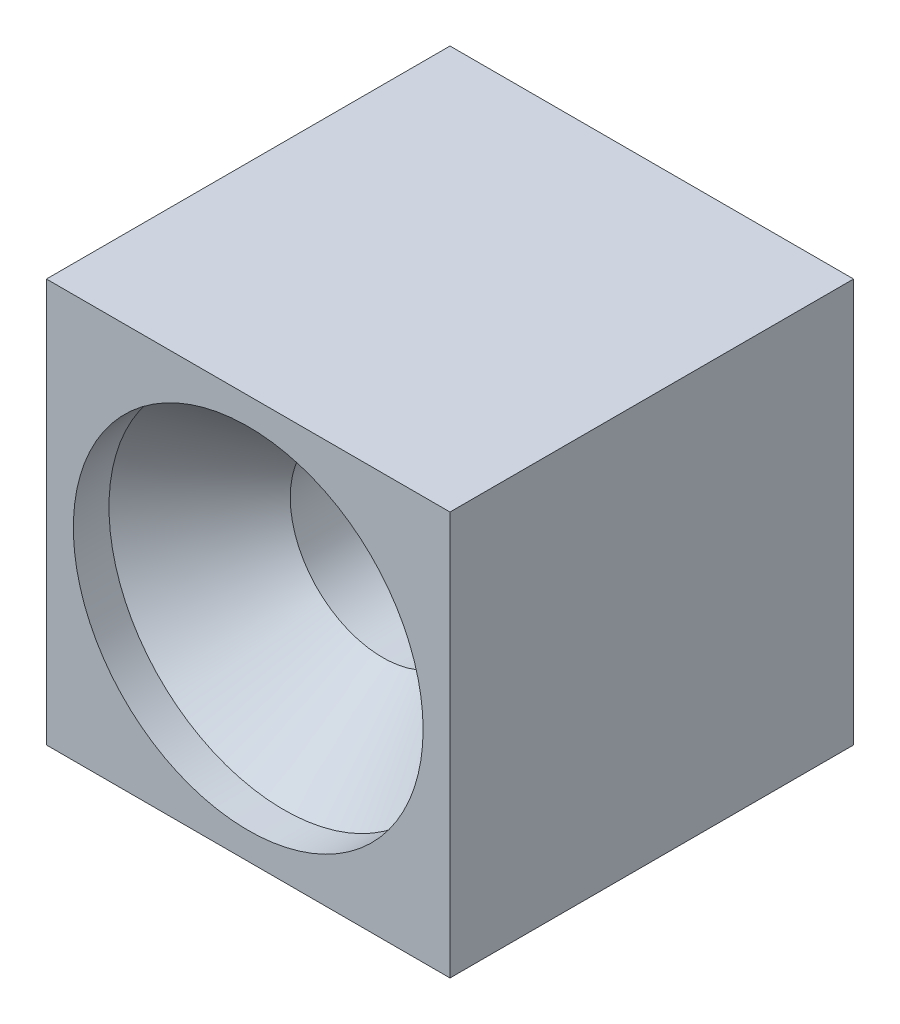
from build123d import *

# Parameters (mm, degrees)
SKETCH1_W           = 12
SKETCH1_H           = 12
SKETCH1_R           = 2.75
BOSS_EXTRUDE1_DEPTH = 12
SKETCH2_R           = 5.2
CUT_EXTRUDE1_DEPTH  = 1
CHAMFER1_SIZE       = 3
CHAMFER1_SIZE_2     = 2.5
CHAMFER2_SIZE       = 0.5


with BuildPart() as part:
    # Sketch1 → Boss-Extrude1 (new body)
    with BuildSketch(Plane.XY):
        Rectangle(SKETCH1_W, SKETCH1_H)
        Circle(SKETCH1_R, mode=Mode.SUBTRACT)
    extrude(amount=BOSS_EXTRUDE1_DEPTH)

    # Sketch2 → Cut-Extrude1 (cut)
    with BuildSketch(Plane.XY.offset(12)):
        Circle(SKETCH2_R)
    extrude(amount=-CUT_EXTRUDE1_DEPTH, mode=Mode.SUBTRACT)

    # Chamfer1
    # the kernel refuses this chamfer: 3, 2.5 mm, written as the material it takes off along each edge
    with BuildSketch(Plane(origin=(0, 0, 11), x_dir=(1, 0, 0), z_dir=(0, 1, 0))) as chamfer1_piece_1_section:
        Polygon((2.75, CHAMFER1_SIZE), (2.75 + CHAMFER1_SIZE_2, 0), (2.75, 0), align=None)
    chamfer1_piece_1 = revolve(axis=Axis((0, 0, 11), (0, 0, -1)), mode=Mode.PRIVATE)
    chamfer1_piece_1 = chamfer1_piece_1 & Plane(origin=(0, 0, 9.452892591), x_dir=(1, 0, 0), z_dir=(0, 0, 1)) * Cylinder(5.2, 21, mode=Mode.PRIVATE)
    add(chamfer1_piece_1, mode=Mode.SUBTRACT)

    # Chamfer2
    chamfer2_edges = [part.edges().sort_by_distance(p)[0] for p in [
        (-2.75, 0, 0),
    ]]
    chamfer(chamfer2_edges, length=CHAMFER2_SIZE)


solid = part.part
